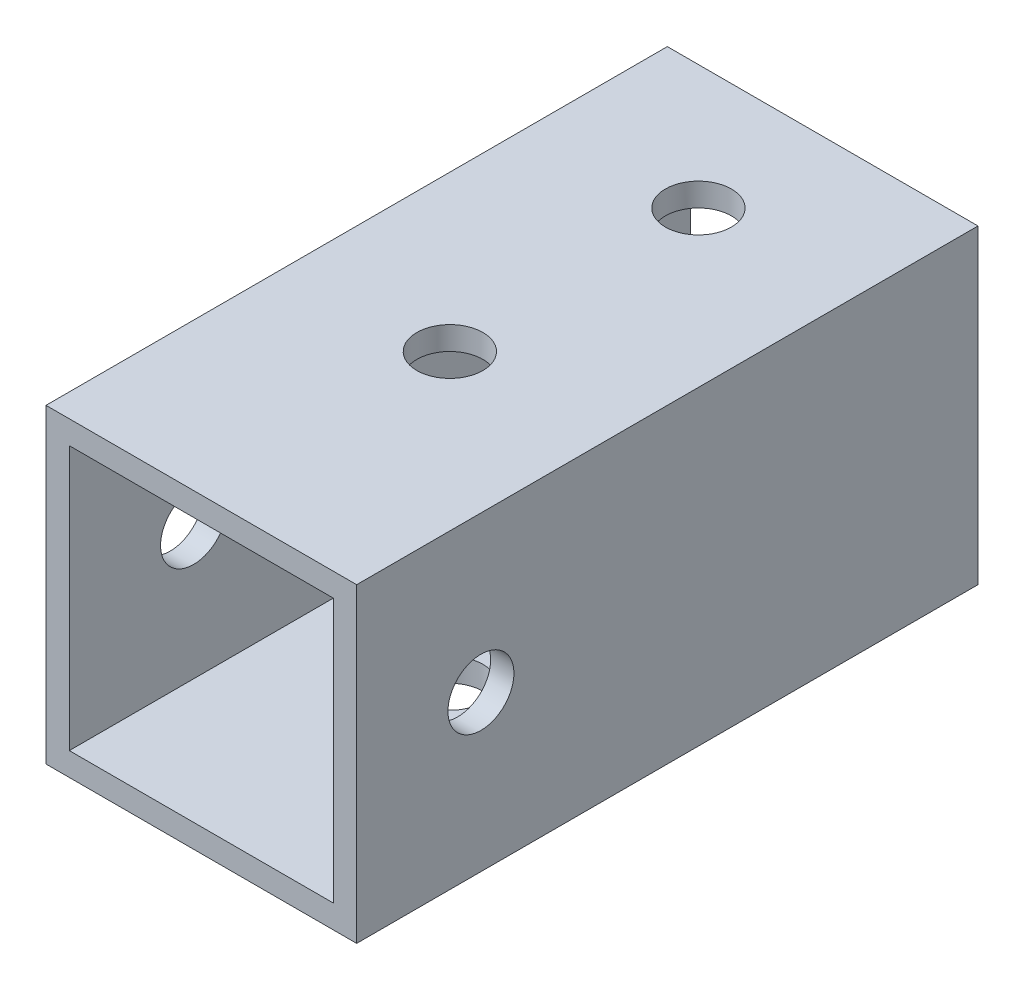
from build123d import *

# Parameters (mm, degrees)
SKETCH1_W           = 20
SKETCH1_H           = 20
SKETCH1_W_2         = 17
SKETCH1_H_2         = 17
BOSS_EXTRUDE1_DEPTH = 40
SKETCH2_R           = 2.125
CUT_EXTRUDE1_DEPTH  = 46.82575695
SKETCH3_R           = 2.125
CUT_EXTRUDE2_DEPTH  = 46.82575695


with BuildPart() as part:
    # Sketch1 → Boss-Extrude1 (new body)
    with BuildSketch(Plane.XY):
        Rectangle(SKETCH1_W, SKETCH1_H)
        Rectangle(SKETCH1_W_2, SKETCH1_H_2, mode=Mode.SUBTRACT)
    extrude(amount=-BOSS_EXTRUDE1_DEPTH)

    # Sketch2 → Cut-Extrude1 (cut, through all)
    with BuildSketch(Plane(origin=(0, 10, 0), x_dir=(1, 0, 0), z_dir=(0, 1, 0))):
        with Locations((0, 32)):
            Circle(SKETCH2_R)
        with Locations((0, 16)):
            Circle(SKETCH2_R)
    extrude(amount=-CUT_EXTRUDE1_DEPTH, mode=Mode.SUBTRACT)

    # Sketch3 → Cut-Extrude2 (cut, through all)
    with BuildSketch(Plane(origin=(10, 0, 0), x_dir=(0, 0, -1), z_dir=(1, 0, 0))):
        with Locations((8, 0)):
            Circle(SKETCH3_R)
    extrude(amount=-CUT_EXTRUDE2_DEPTH, mode=Mode.SUBTRACT)


solid = part.part
